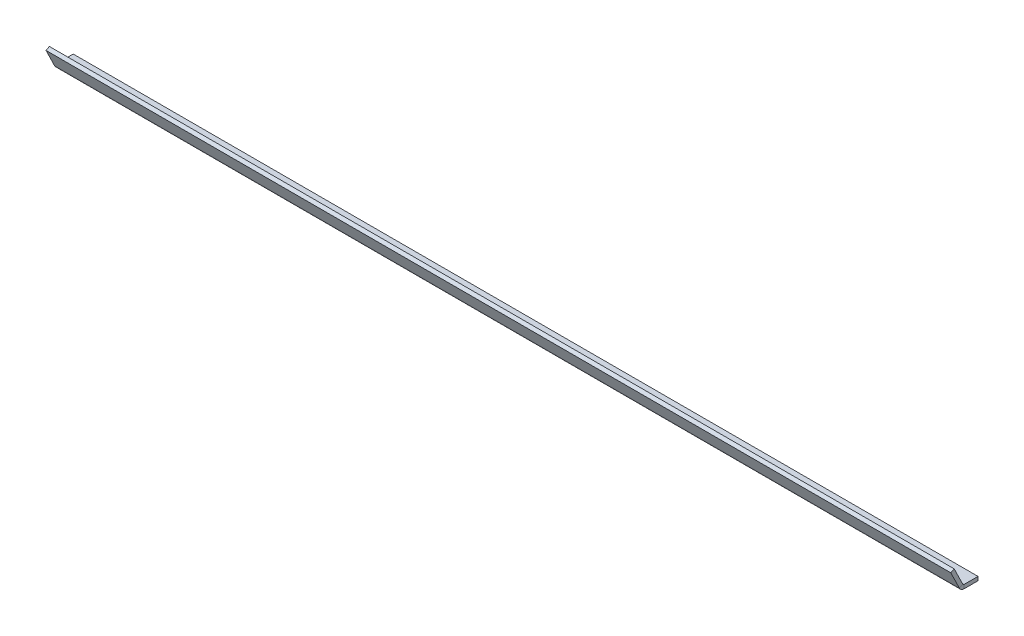
from build123d import *

# Parameters (mm, degrees)
SKETCH2_W            = 1900
SKETCH2_H            = 40
BASE_FLANGE1_DEPTH   = 8
EDGE_FLANGE1_START   = -950
EDGE_FLANGE1_DEPTH   = 1900
EDGE_FLANGE1_2_DEPTH = 1900


# Read off the part's stored shape, not the designer's step: Edge-Flange1
# Sheet-metal steps are written as plain solids
with BuildPart() as part:
    # Sketch2 → Base-Flange1 (new body)
    with BuildSketch(Plane(origin=(0, 0, 0), x_dir=(1, 0, 0), z_dir=(0, 1, 0))):
        with Locations((0, 20)):
            Rectangle(SKETCH2_W, SKETCH2_H)
    extrude(amount=-BASE_FLANGE1_DEPTH)

    # Edge-Flange1 outline → Edge-Flange1 (cut)
    with BuildSketch(Plane.YZ.offset(EDGE_FLANGE1_START)):
        with BuildLine():
            ThreePointArc((-8, -10.77542358), (-6.328529058, -4.946311673), (-1.822082615, -0.88868907))
            Line((-1.822082615, -0.88868907), (0, 0))
            Line((0, 0), (-8, 0))
            Line((-8, 0), (-8, -10.77542358))
        make_face()
    extrude(amount=EDGE_FLANGE1_DEPTH, mode=Mode.SUBTRACT)

    # Edge-Flange1 2 outline → Edge-Flange1 2 (add)
    with BuildSketch(Plane.YZ.offset(EDGE_FLANGE1_START)):
        with BuildLine():
            Line((35.142114222, 17.139954337), (0, 0))
            Line((0, 0), (0, -10.77542358))
            ThreePointArc((0, -10.77542358), (0.455855712, -9.185665787), (1.68488656, -8.079041441))
            Line((1.68488656, -8.079041441), (38.649083397, 9.949601967))
            Line((38.649083397, 9.949601967), (35.142114222, 17.139954337))
        make_face()
    extrude(amount=EDGE_FLANGE1_2_DEPTH)


solid = part.part
